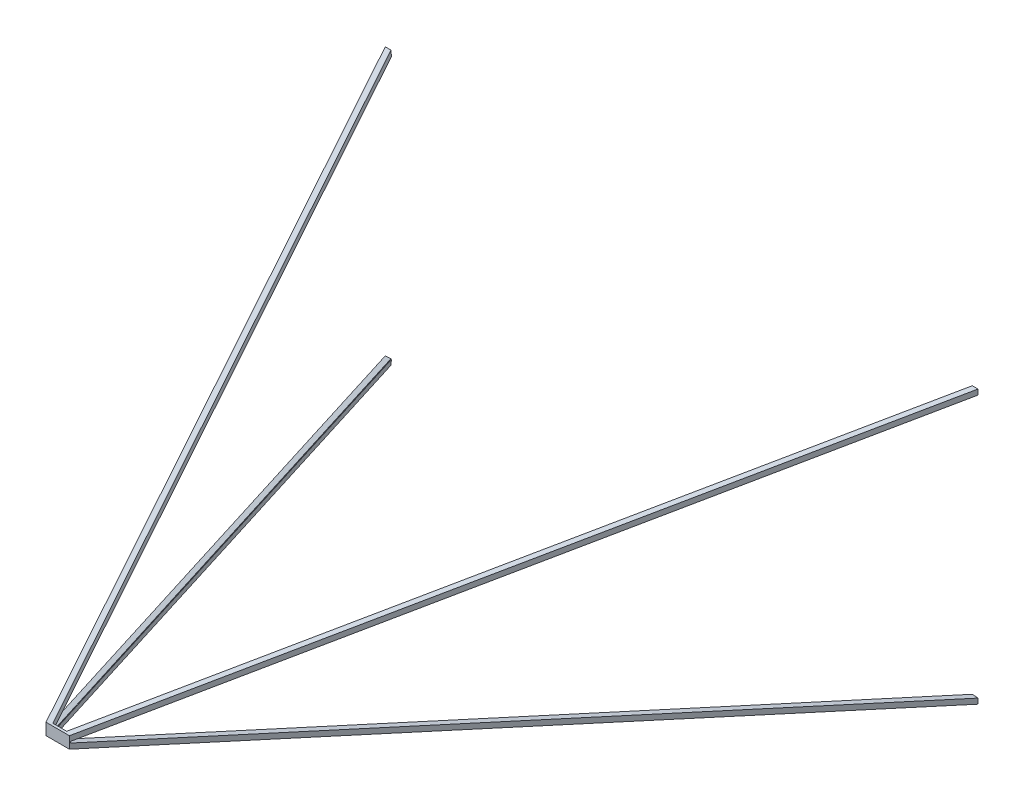
from build123d import *

# Parameters (mm, degrees)
SHELL1_T         = -8.466666667
EXTRUSION3_DEPTH = 8.466666667
EXTRUSION4_DEPTH = 8.466666667
EXTRUSION5_DEPTH = 8.466666667
EXTRUSION6_DEPTH = 8.466666667


with BuildPart() as part:
    # Extrusion2: read off the stored shape, not the designer's step
    # Extrusion2: loft between two sections, ruled curve by curve
    extrusion2_from = [
        Edge.make_line((-482.6, -222.25, 2.54), (482.6, -222.25, 2.54)),
        Edge.make_line((-482.6, 222.25, 2.54), (-482.6, -222.25, 2.54)),
        Edge.make_line((482.6, 222.25, 2.54), (-482.6, 222.25, 2.54)),
        Edge.make_line((482.6, -222.25, 2.54), (482.6, 222.25, 2.54)),
    ]
    extrusion2_to = [
        Edge.make_line((-19.05, -9.525, 1018.54), (19.05, -9.525, 1018.54)),
        Edge.make_line((-19.05, 9.525, 1018.54), (-19.05, -9.525, 1018.54)),
        Edge.make_line((19.05, 9.525, 1018.54), (-19.05, 9.525, 1018.54)),
        Edge.make_line((19.05, -9.525, 1018.54), (19.05, 9.525, 1018.54)),
    ]
    extrusion2 = Solid(Shell([*[Face.make_surface_from_curves(extrusion2_from[k], extrusion2_to[k]) for k in range(4)], Face(Wire(extrusion2_from)), Face(Wire(extrusion2_to))]))
    add(extrusion2)

    # Shell1
    shell1_openings = [part.faces().sort_by_distance(p)[0] for p in [
        (0, 0, 2.54),
    ]]
    offset(amount=SHELL1_T, openings=shell1_openings, kind=Kind.INTERSECTION)

    # Sketch2 → Extrusion3 (cut)
    with BuildSketch(Plane(origin=(400.408264089, 0, 182.68627049), x_dir=(0.4150877539122262, 0, -0.9097813784377559), z_dir=(0.909781378437756, 0, 0.41508775391222624))):
        Polygon((-917.157013109, 1.207881), (-917.157013109, -1.207881), (198.010505337, -213.631096694), (198.010505337, 213.631096694), align=None)
    extrude(amount=-EXTRUSION3_DEPTH, mode=Mode.SUBTRACT)

    # Sketch3 → Extrusion4 (cut)
    with BuildSketch(Plane(origin=(-400.408264089, 0, 182.68627049), x_dir=(0.4150877539122262, 0, 0.9097813784377559), z_dir=(-0.909781378437756, 0, 0.41508775391222624))):
        Polygon((917.157013109, -1.207881), (917.157013109, 1.207881), (-198.010505337, 213.631096694), (-198.010505337, -213.631096694), align=None)
    extrude(amount=-EXTRUSION4_DEPTH, mode=Mode.SUBTRACT)

    # Sketch4 → Extrusion5 (cut)
    with BuildSketch(Plane(origin=(0, 213.425680846, 44.686001927), x_dir=(-1, 0, 0), z_dir=(0, 0.9787763596240335, 0.204931300296282))):
        Polygon((-11.319163518, 991.518568451), (-473.327465959, -43.059889537), (473.327465959, -43.059889537), (11.319163518, 991.518568451), align=None)
    extrude(amount=-EXTRUSION5_DEPTH, mode=Mode.SUBTRACT)

    # Sketch5 → Extrusion6 (cut)
    with BuildSketch(Plane(origin=(0, -213.425680846, 44.686001927), x_dir=(1, 0, 0), z_dir=(0, -0.9787763596240335, 0.204931300296282))):
        Polygon((-11.319163518, 991.518568451), (-473.327465959, -43.059889537), (473.327465959, -43.059889537), (11.319163518, 991.518568451), align=None)
    extrude(amount=-EXTRUSION6_DEPTH, mode=Mode.SUBTRACT)


solid = part.part
